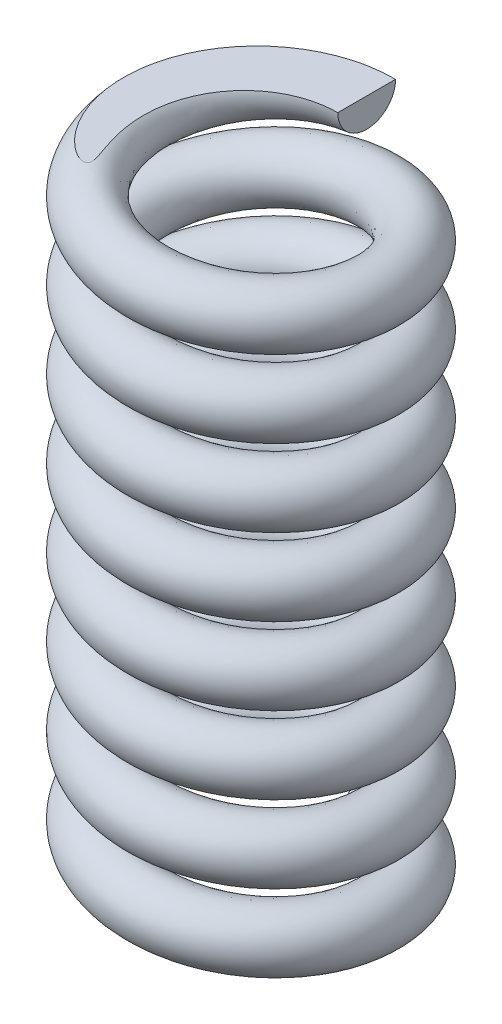
from build123d import *
from OCP.BRepAlgoAPI import BRepAlgoAPI_Cut
from OCP.TopTools import TopTools_ListOfShape

# Parameters (mm, degrees)
SWEEP1_PITCH       = 40
SWEEP1_HEIGHT      = 320
SWEEP1_RADIUS      = 60
SWEEP1_START_ANGLE = -180
SKETCH4_R          = 15
SKETCH5_W          = 150
SKETCH5_H          = 40
SKETCH5_H_2        = 38.071533255
CUT_EXTRUDE1_DEPTH = 85


with BuildPart() as part:
    # Sweep1: sweep along a helix
    with BuildLine() as sweep1_path:
        add(Helix(SWEEP1_PITCH, SWEEP1_HEIGHT, SWEEP1_RADIUS, center=(0, 0, 0), direction=(0, 1, 0), lefthand=True, mode=Mode.PRIVATE).rotate(Axis((0, 0, 0), (0, 1, 0)), SWEEP1_START_ANGLE))
    # Sketch4 → Sweep1 (sweep)
    with BuildSketch(Plane(origin=(0, 0, 0), x_dir=(0, 0, -1), z_dir=(1, 0, 0))):
        with Locations((60, 0)):
            Circle(SKETCH4_R)
    sweep(path=sweep1_path.line, is_frenet=True)


with BuildPart() as cut_extrude1_tool:
    # Sketch5 → Cut-Extrude1 (new, symmetric)
    with BuildSketch(Plane(origin=(0, 0, 0), x_dir=(0, 0, -1), z_dir=(1, 0, 0))):
        with Locations((0, -20)):
            Rectangle(SKETCH5_W, SKETCH5_H)
        with Locations((0, 339.035766628)):
            Rectangle(SKETCH5_W, SKETCH5_H_2)
    extrude(amount=CUT_EXTRUDE1_DEPTH, both=True)


with BuildPart() as part_1:
    add(part.part)

    # Cut-Extrude1: cut by cut_extrude1_tool, with a tolerance
    cut_extrude1_stock = TopTools_ListOfShape()
    cut_extrude1_stock.Append(part_1.part.wrapped)
    cut_extrude1_tools = TopTools_ListOfShape()
    cut_extrude1_tools.Append(cut_extrude1_tool.part.wrapped)
    cut_extrude1_cut = BRepAlgoAPI_Cut()
    cut_extrude1_cut.SetArguments(cut_extrude1_stock)
    cut_extrude1_cut.SetTools(cut_extrude1_tools)
    cut_extrude1_cut.SetFuzzyValue(0.00001)
    cut_extrude1_cut.Build()
    add(Compound.cast(cut_extrude1_cut.Shape()).solids(), mode=Mode.REPLACE)


solid = part_1.part
